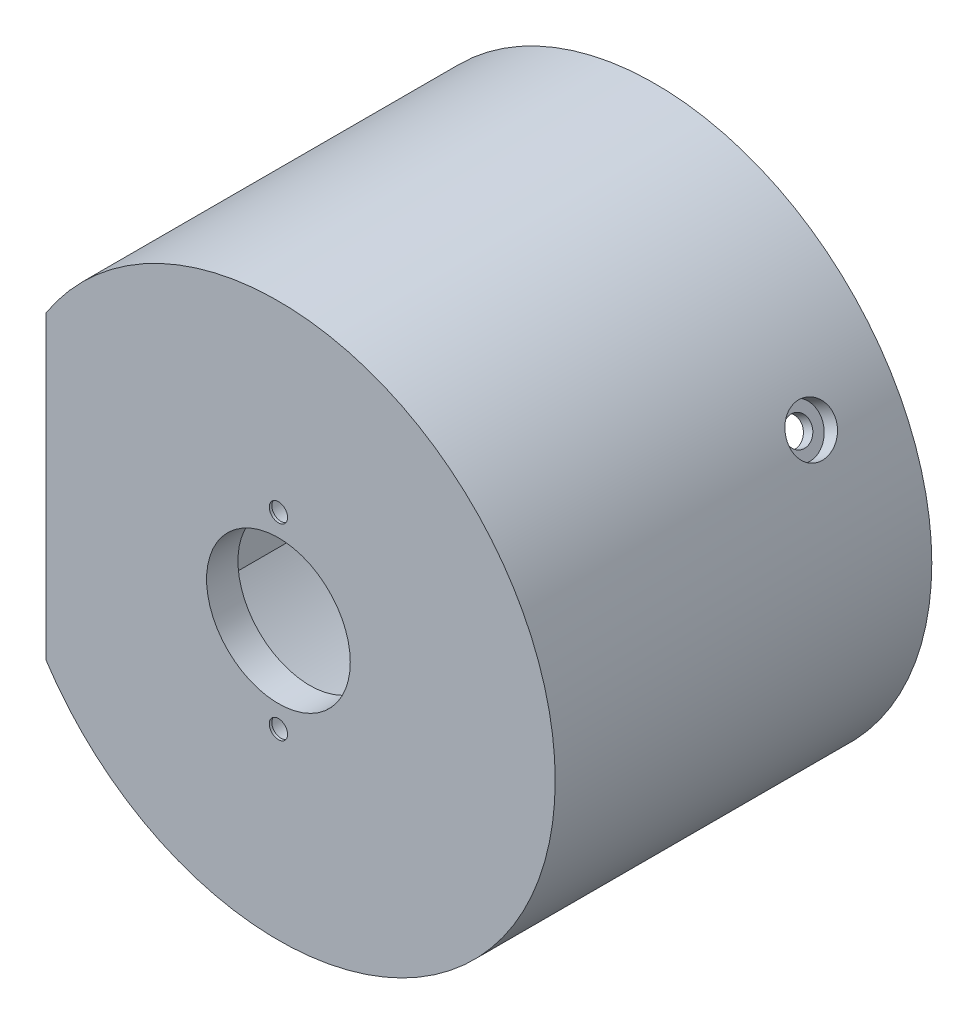
from build123d import *

# Parameters (mm, degrees)
BOSS_EXTRUDE1_DEPTH                             = 39.878
BOSS_EXTRUDE2_START                             = -3.175
BOSS_EXTRUDE2_DEPTH                             = 3.175
CBORE_FOR_2_PAN_HEAD_MACHINE_SCREW1_D           = 2.7051
CBORE_FOR_2_PAN_HEAD_MACHINE_SCREW1_DEPTH       = 2.667
CBORE_FOR_2_PAN_HEAD_MACHINE_SCREW1_CBORE_D     = 4.7625
CBORE_FOR_2_PAN_HEAD_MACHINE_SCREW1_CBORE_DEPTH = 1.5748
CBORE_START                                     = 26.4287
CBORE_FOR_2_PAN_HEAD_MACHINE_SCREW2_OUT_R       = 2.38125
CBORE_FOR_2_PAN_HEAD_MACHINE_SCREW2_DEPTH       = 1.574800075
CBORE_START_2                                   = 25.300372244
CBORE_FOR_2_PAN_HEAD_MACHINE_SCREW2_2_O_R       = 1.35255
CBORE_FOR_2_PAN_HEAD_MACHINE_SCREW2_2_DEPTH     = 1.128327756
CBORE_START_3                                   = -28.003500101
CBORE_FOR_2_PAN_HEAD_MACHINE_SCREW3_OUT_R       = 2.38125
CBORE_FOR_2_PAN_HEAD_MACHINE_SCREW3_DEPTH       = 1.574800101
CBORE_START_4                                   = -26.4287
CBORE_FOR_2_PAN_HEAD_MACHINE_SCREW3_2_O_R       = 1.35255
CBORE_FOR_2_PAN_HEAD_MACHINE_SCREW3_2_DEPTH     = 1.128327733
CUT_EXTRUDE1_REACH                              = 58.202
SKETCH20_R                                      = 7.27
HOLE1_AT_2_COUNT                                = 2
HOLE1_AT_2_PITCH                                = 19
F_0_CLEARANCE_HOLE1_D                           = 1.8542
CUT_EXTRUDE2_DEPTH                              = 1.778
CHAMFER1_SIZE                                   = 1.27


# Read off the part's stored shape, not the designer's step: CBORE for #2 Pan Head Machine Screw2, CBORE for #2 Pan Head Machine Screw3
with BuildPart() as part:
    # Sketch1 → Boss-Extrude1 (new body)
    with BuildSketch(Plane.XY):
        with BuildLine():
            Line((-23.495, 15.237486251), (-23.495, -15.237486251))
            ThreePointArc((-23.495, -15.237486251), (28.0035, 0), (-23.495, 15.237486251))
        make_face()
        with BuildLine():
            Line((-20.828, 14.42680312), (-20.828, -14.42680312))
            ThreePointArc((-20.828, -14.42680312), (25.3365, 0), (-20.828, 14.42680312))
        make_face(mode=Mode.SUBTRACT)
    extrude(amount=BOSS_EXTRUDE1_DEPTH)

    # Sketch10 → Boss-Extrude2 (add)
    with BuildSketch(Plane.XY.offset(39.878).offset(BOSS_EXTRUDE2_START)):
        with BuildLine():
            Line((-23.495, 15.237486251), (-23.495, -15.237486251))
            ThreePointArc((-23.495, -15.237486251), (28.0035, 0), (-23.495, 15.237486251))
        make_face()
    extrude(amount=BOSS_EXTRUDE2_DEPTH)

    # CBORE for #2 Pan Head Machine Screw1
    with Locations(Plane(origin=(-23.495, 13.798981486, 10.2108), x_dir=(0, 0, -1), z_dir=(-1, 0, 0))):
        with Locations((1.6708, 13.798981486)):
            CounterBoreHole(CBORE_FOR_2_PAN_HEAD_MACHINE_SCREW1_D / 2, CBORE_FOR_2_PAN_HEAD_MACHINE_SCREW1_CBORE_D / 2, CBORE_FOR_2_PAN_HEAD_MACHINE_SCREW1_CBORE_DEPTH, depth=CBORE_FOR_2_PAN_HEAD_MACHINE_SCREW1_DEPTH)

    # CBORE for #2 Pan Head Machine Screw2 out → CBORE for #2 Pan Head Machine Screw2 (cut)
    with BuildSketch(Plane(origin=(0, 0, 0), x_dir=(0.500000000000004, -0.8660254037844363, 0), z_dir=(0.8660254037844363, 0.5000000000000042, 0)).offset(CBORE_START)):
        with Locations((0, -10.2108)):
            Circle(CBORE_FOR_2_PAN_HEAD_MACHINE_SCREW2_OUT_R)
    extrude(amount=CBORE_FOR_2_PAN_HEAD_MACHINE_SCREW2_DEPTH, mode=Mode.SUBTRACT)

    # CBORE for _2 Pan Head Machine Screw2 2 o → CBORE for _2 Pan Head Machine Screw2 2 (cut)
    with BuildSketch(Plane(origin=(0, 0, 0), x_dir=(0.500000000000004, -0.8660254037844363, 0), z_dir=(0.8660254037844363, 0.5000000000000042, 0)).offset(CBORE_START_2)):
        with Locations((0, -10.2108)):
            Circle(CBORE_FOR_2_PAN_HEAD_MACHINE_SCREW2_2_O_R)
    extrude(amount=CBORE_FOR_2_PAN_HEAD_MACHINE_SCREW2_2_DEPTH, mode=Mode.SUBTRACT)

    # CBORE for #2 Pan Head Machine Screw3 out → CBORE for #2 Pan Head Machine Screw3 (cut)
    with BuildSketch(Plane(origin=(0, 0, 0), x_dir=(1, 0, 0), z_dir=(0, 1, 0)).offset(CBORE_START_3)):
        with Locations((0, -10.2108)):
            Circle(CBORE_FOR_2_PAN_HEAD_MACHINE_SCREW3_OUT_R)
    extrude(amount=CBORE_FOR_2_PAN_HEAD_MACHINE_SCREW3_DEPTH, mode=Mode.SUBTRACT)

    # CBORE for _2 Pan Head Machine Screw3 2 o → CBORE for _2 Pan Head Machine Screw3 2 (cut)
    with BuildSketch(Plane(origin=(0, 0, 0), x_dir=(1, 0, 0), z_dir=(0, 1, 0)).offset(CBORE_START_4)):
        with Locations((0, -10.2108)):
            Circle(CBORE_FOR_2_PAN_HEAD_MACHINE_SCREW3_2_O_R)
    extrude(amount=CBORE_FOR_2_PAN_HEAD_MACHINE_SCREW3_2_DEPTH, mode=Mode.SUBTRACT)

    # Sketch20 → Cut-Extrude1 (cut, up to next)
    with BuildSketch(Plane.XY.offset(39.878), mode=Mode.PRIVATE) as cut_extrude1_sk1:
        Circle(SKETCH20_R)
    cut_extrude1_tool1 = extrude(cut_extrude1_sk1.sketch, amount=-CUT_EXTRUDE1_REACH, mode=Mode.PRIVATE) & part.part
    add(cut_extrude1_tool1.solids().sort_by_distance((0, 0, 39.878))[0], mode=Mode.SUBTRACT)

    # Sketch22 → Hole1 (revolve, cut)
    with BuildSketch(Plane(origin=(0, 9.5, 36.703), x_dir=(0, 1, 0), z_dir=(1, 0, 0))):
        Polygon((0, 0), (0, 2.921), (1.4986, 2.921), (1.6383, 0), align=None)
    hole1 = revolve(axis=Axis((0, 9.5, 146.703), (0, 0, -1)), mode=Mode.SUBTRACT)

    # Hole1 at 2: Hole1 ×2
    with Locations(*[(0, -i * HOLE1_AT_2_PITCH, 0) for i in range(1, HOLE1_AT_2_COUNT)]):
        add(hole1, mode=Mode.SUBTRACT)

    # #0 Clearance Hole1 (through all)
    with Locations(Plane(origin=(0, 0, 36.703), x_dir=(-1, 0, 0), z_dir=(0, 0, -1))):
        with Locations((0, 9.5), (0, -9.5)):
            Hole(F_0_CLEARANCE_HOLE1_D / 2)

    # Sketch25 → Cut-Extrude2 (cut)
    with BuildSketch(Plane(origin=(0, 0, 0), x_dir=(-1, 0, 0), z_dir=(0, 0, -1))):
        with BuildLine():
            Line((23.495, -15.237486251), (23.495, 15.237486251))
            ThreePointArc((23.495, 15.237486251), (-28.0035, 0), (23.495, -15.237486251))
        make_face()
        with BuildLine():
            Line((20.828, -14.42680312), (20.828, 14.42680312))
            ThreePointArc((20.828, 14.42680312), (-25.3365, 0), (20.828, -14.42680312))
        make_face(mode=Mode.SUBTRACT)
    extrude(amount=-CUT_EXTRUDE2_DEPTH, mode=Mode.SUBTRACT)

    # Chamfer1
    chamfer1_edges = [part.edges().sort_by_distance(p)[0] for p in [
        (-20.828, 0, 1.778),
        (25.3365, 0, 1.778),
    ]]
    chamfer(chamfer1_edges, length=CHAMFER1_SIZE)


solid = part.part
